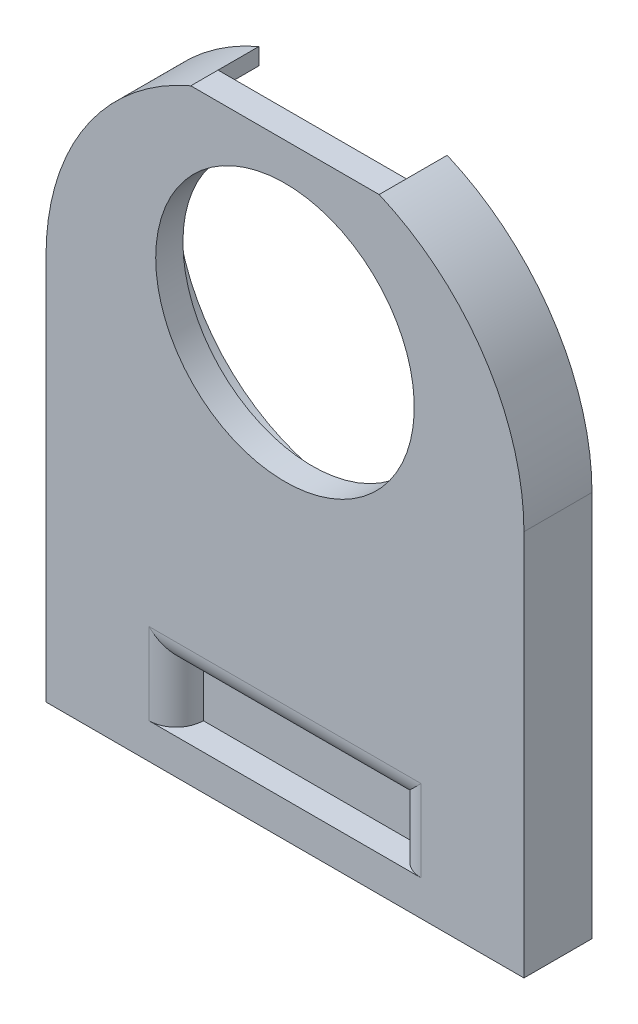
from build123d import *

# Parameters (mm, degrees)
BOSS_EXTRUDE1_DEPTH = 1.5
BOSS_EXTRUDE2_DEPTH = 1
SKETCH4_R           = 4.75
CUT_EXTRUDE1_DEPTH  = 23.898325822
SKETCH5_W           = 17.56
SKETCH5_H           = 2.5
BOSS_EXTRUDE3_DEPTH = 0.15
SKETCH6_W           = 17.56
SKETCH6_H           = 2.5
BOSS_EXTRUDE4_DEPTH = 7.5
SKETCH9_W           = 8
SKETCH9_H           = 2
CUT_EXTRUDE2_DEPTH  = 1
FILLET1_R           = 1


with BuildPart() as part:
    # Sketch1 → Boss-Extrude1 (new body)
    with BuildSketch(Plane.XY):
        with BuildLine():
            ThreePointArc((14.980604809, 6.55), (8.78, 2), (2.579395191, 6.55))
            Line((2.579395191, 6.55), (0, 6.55))
            Line((0, 6.55), (0, 0))
            Line((0, 0), (17.56, 0))
            Line((17.56, 0), (17.56, 6.55))
            Line((17.56, 6.55), (14.980604809, 6.55))
        make_face()
        with BuildLine():
            ThreePointArc((2.579395191, 6.55), (2.679421093, 10.743420825), (5.32, 14.002581212))
            Line((5.32, 14.002581212), (5.32, 14.619498126))
            ThreePointArc((5.32, 14.619498126), (1.449679407, 11.382680416), (0, 6.55))
            Line((0, 6.55), (2.579395191, 6.55))
        make_face()
        with BuildLine():
            ThreePointArc((12.24, 14.002581212), (14.880578907, 10.743420825), (14.980604809, 6.55))
            Line((14.980604809, 6.55), (17.56, 6.55))
            ThreePointArc((17.56, 6.55), (16.110320593, 11.382680416), (12.24, 14.619498126))
            Line((12.24, 14.619498126), (12.24, 14.002581212))
        make_face()
    extrude(amount=BOSS_EXTRUDE1_DEPTH)

    # Sketch3 → Boss-Extrude2 (add)
    with BuildSketch(Plane.XY.offset(1.5)):
        with BuildLine():
            Line((12.24, 14.619498126), (12.24, 14.002581212))
            ThreePointArc((12.24, 14.002581212), (8.78, 2), (5.32, 14.002581212))
            Line((5.32, 14.002581212), (5.32, 14.619498126))
            ThreePointArc((5.32, 14.619498126), (1.449679407, 11.382680416), (0, 6.55))
            Line((0, 6.55), (0, 0))
            Line((0, 0), (17.56, 0))
            Line((17.56, 0), (17.56, 6.55))
            ThreePointArc((17.56, 6.55), (16.110320593, 11.382680416), (12.24, 14.619498126))
        make_face()
        with BuildLine():
            Line((5.32, 14.619498126), (12.24, 14.619498126))
            Line((12.24, 14.619498126), (12.24, 14.002581212))
            ThreePointArc((12.24, 14.002581212), (8.78, 2), (5.32, 14.002581212))
            Line((5.32, 14.002581212), (5.32, 14.619498126))
        make_face()
    extrude(amount=BOSS_EXTRUDE2_DEPTH)

    # Sketch4 → Cut-Extrude1 (cut, through all)
    with BuildSketch(Plane(origin=(0, 0, 1.5), x_dir=(-1, 0, 0), z_dir=(0, 0, -1))):
        with Locations((-8.78, 8.5)):
            Circle(SKETCH4_R)
    extrude(amount=-CUT_EXTRUDE1_DEPTH, mode=Mode.SUBTRACT)

    # Sketch5 → Boss-Extrude3 (add)
    with BuildSketch(Plane.XZ):
        with Locations((8.78, 1.25)):
            Rectangle(SKETCH5_W, SKETCH5_H)
    extrude(amount=BOSS_EXTRUDE3_DEPTH)

    # Sketch6 → Boss-Extrude4 (add)
    with BuildSketch(Plane.XZ.offset(0.15)):
        with Locations((8.78, 1.25)):
            Rectangle(SKETCH6_W, SKETCH6_H)
    extrude(amount=BOSS_EXTRUDE4_DEPTH)

    # Sketch9 → Cut-Extrude2 (cut)
    with BuildSketch(Plane.XY.offset(2.5)):
        with Locations((8.78, -5.353166831)):
            Rectangle(SKETCH9_W, SKETCH9_H)
    extrude(amount=-CUT_EXTRUDE2_DEPTH, mode=Mode.SUBTRACT)

    # Fillet1
    fillet1_edges = [part.edges().sort_by_distance(p)[0] for p in [
        (4.78, -5.353166831, 2.5),
        (12.78, -5.353166831, 2.5),
        (8.78, -4.353166831, 2.5),
    ]]
    fillet(fillet1_edges, radius=FILLET1_R - 0.0001)  # a hair under: the kernel refuses the full size


solid = part.part
